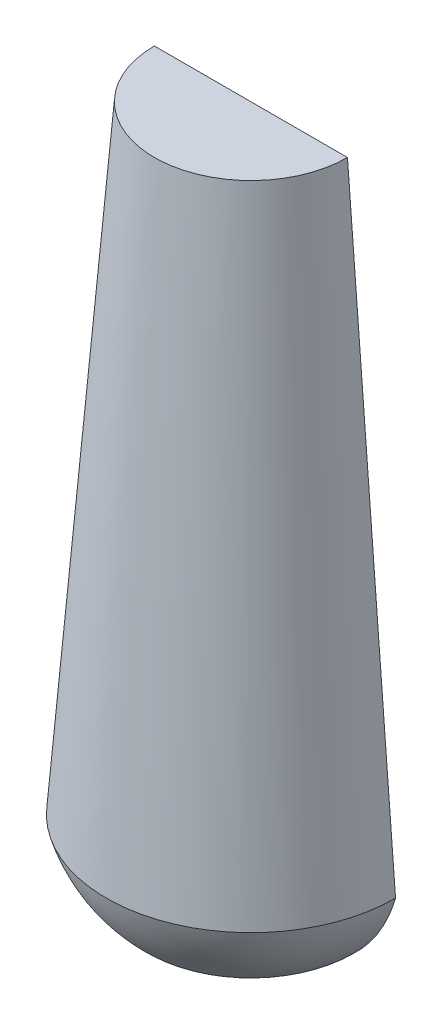
from build123d import *

# Parameters (mm, degrees)
REVOLVE1_ANGLE = 180


with BuildPart() as part:
    # Sketch1 → Revolve1 (revolve)
    with BuildSketch(Plane.XY):
        with BuildLine():
            Line((27.686, 0), (22.606, 0))
            Line((22.606, 0), (22.606, 1.8288))
            add(Edge.make_bspline(
                [(22.606, 1.8288), (25.041168082, 1.8288), (27.106875675, 2.820982452), (28.829, 4.191)],
                knots=[0, 0, 0, 0, 0.286842678, 0.286842678, 0.286842678, 0.286842678], degree=3))
            Line((28.829, 4.191), (22.606, 4.191))
            Line((22.606, 4.191), (22.606, 5.8928))
            Line((22.606, 5.8928), (30.607, 5.8928))
            add(Edge.make_bspline(
                [(30.607, 5.8928), (33.141617237, 8.764866731), (34.785171834, 12.709901725), (35.859788843, 16.222586258)],
                knots=[0.392904056, 0.392904056, 0.392904056, 0.392904056, 0.881974497, 0.881974497, 0.881974497, 0.881974497], degree=3))
            Line((35.859788843, 16.222586258), (0, 16.222586258))
            Line((0, 16.222586258), (0, 185.547))
            Line((0, 185.547), (26.0985, 185.547))
            Line((26.0985, 185.547), (39.0906, 18.669))
            add(Edge.make_bspline(
                [(27.686, 0), (33.049868002, 5.001887832), (36.872104374, 11.202594013), (39.0906, 18.669)],
                knots=[0, 0, 0, 0, 1, 1, 1, 1], degree=3))
        make_face()
    revolve(axis=Axis((0, 16.222586258, 0), (0, -1, 0)), revolution_arc=REVOLVE1_ANGLE)


solid = part.part
